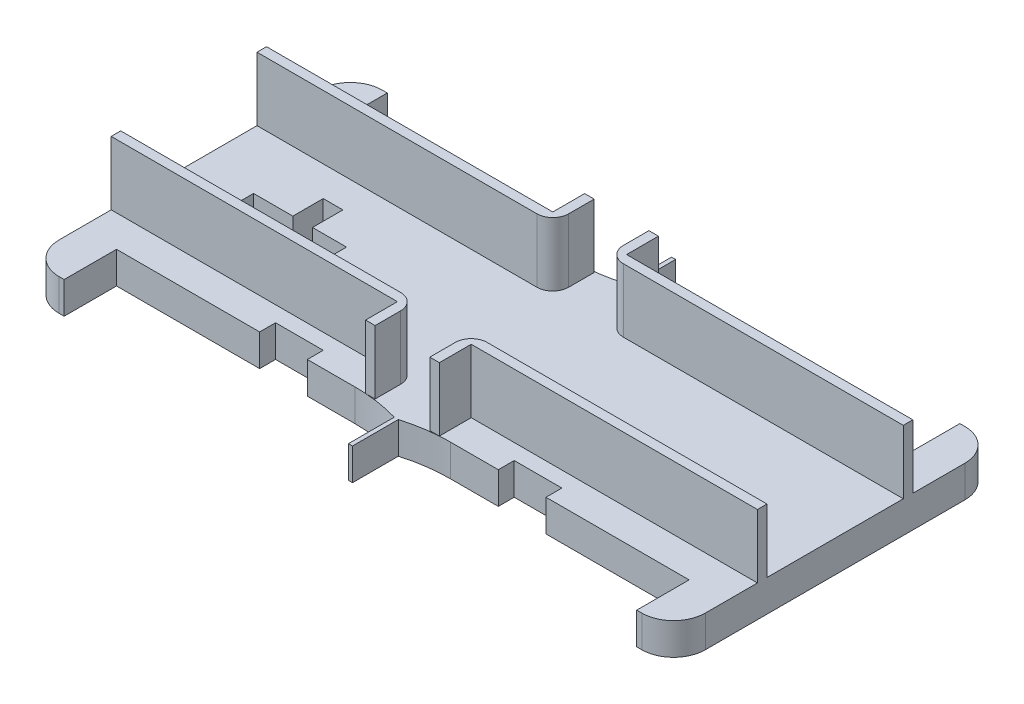
from build123d import *

# Parameters (mm, degrees)
SKETCH1_W            = 203.2
SKETCH1_H            = 101.6
BOSS_EXTRUDE1_DEPTH  = 10
CUT_EXTRUDE1_DEPTH   = 115.031574575
MIRROR3_COPY_1_DEPTH = 115.031574575
FILLET2_R            = 10
FILLET3_R            = 10
FILLET4_R            = 10
FILLET5_R            = 10
CUT_EXTRUDE2_DEPTH   = 115.031574575
BOSS_EXTRUDE8_DEPTH  = 20
FILLET9_R            = 5
FILLET9_OF_MIRROR7_R = 5
MIRROR9_START        = 10
MIRROR9_DEPTH        = 20


# Read off the part's stored shape, not the designer's step: Mirror9
with BuildPart() as part:
    # Sketch1 → Boss-Extrude1 (new body)
    with BuildSketch(Plane(origin=(0, 0, 0), x_dir=(1, 0, 0), z_dir=(0, 1, 0))):
        Rectangle(SKETCH1_W, SKETCH1_H)
    extrude(amount=BOSS_EXTRUDE1_DEPTH)

    # Sketch4 → Cut-Extrude1 (cut, through all)
    with BuildSketch(Plane(origin=(0, 10, 0), x_dir=(1, 0, 0), z_dir=(0, 1, 0))):
        with BuildLine():
            Line((-30.016608914, 34.326781051), (-15.016608914, 34.326781051))
            ThreePointArc((-15.016608914, 34.326781051), (-7.755121488, 34.843235841), (-0.639820714, 36.382203056))
            Line((-0.639820714, 36.382203056), (-0.639820714, 56.908402461))
            Line((-0.639820714, 56.908402461), (-90.016608914, 56.908402461))
            Line((-90.016608914, 56.908402461), (-90.016608914, 34.326781051))
            Line((-90.016608914, 34.326781051), (-45.016608914, 34.326781051))
            Line((-45.016608914, 34.326781051), (-45.016608914, 29.326781051))
            Line((-45.016608914, 29.326781051), (-30.016608914, 29.326781051))
            Line((-30.016608914, 29.326781051), (-30.016608914, 34.326781051))
        make_face()
    cut_extrude1 = extrude(amount=-CUT_EXTRUDE1_DEPTH, mode=Mode.SUBTRACT)

    # Mirror2: Cut-Extrude1 across plane
    add(cut_extrude1.mirror(Plane.XY), mode=Mode.SUBTRACT)

    # Mirror3: Cut-Extrude1 across plane
    add(cut_extrude1.mirror(Plane(origin=(0, 0, 0), x_dir=(0, 0, 1), z_dir=(1, 0, 0))), mode=Mode.SUBTRACT)

    # Mirror3 copy 1 sketch → Mirror3 copy 1 (cut, through all)
    with BuildSketch(Plane(origin=(0, 10, 0), x_dir=(-1, 0, 0), z_dir=(0, 1, 0))):
        with BuildLine():
            Line((-30.016608914, 34.326781051), (-15.016608914, 34.326781051))
            ThreePointArc((-15.016608914, 34.326781051), (-7.755121488, 34.843235841), (-0.639820714, 36.382203056))
            Line((-0.639820714, 36.382203056), (-0.639820714, 56.908402461))
            Line((-0.639820714, 56.908402461), (-90.016608914, 56.908402461))
            Line((-90.016608914, 56.908402461), (-90.016608914, 34.326781051))
            Line((-90.016608914, 34.326781051), (-45.016608914, 34.326781051))
            Line((-45.016608914, 34.326781051), (-45.016608914, 29.326781051))
            Line((-45.016608914, 29.326781051), (-30.016608914, 29.326781051))
            Line((-30.016608914, 29.326781051), (-30.016608914, 34.326781051))
        make_face()
    extrude(amount=-MIRROR3_COPY_1_DEPTH, mode=Mode.SUBTRACT)

    # Fillet2
    fillet2_edges = [part.edges().sort_by_distance(p)[0] for p in [
        (-101.6, 5, 50.8),
    ]]
    fillet(fillet2_edges, radius=FILLET2_R)

    # Fillet3
    fillet3_edges = [part.edges().sort_by_distance(p)[0] for p in [
        (-101.6, 5, -50.8),
    ]]
    fillet(fillet3_edges, radius=FILLET3_R)

    # Fillet4
    fillet4_edges = [part.edges().sort_by_distance(p)[0] for p in [
        (101.6, 5, -50.8),
    ]]
    fillet(fillet4_edges, radius=FILLET4_R)

    # Fillet5
    fillet5_edges = [part.edges().sort_by_distance(p)[0] for p in [
        (101.6, 5, 50.8),
    ]]
    fillet(fillet5_edges, radius=FILLET5_R)

    # Sketch6 → Cut-Extrude2 (cut, through all)
    with BuildSketch(Plane(origin=(0, 10, 0), x_dir=(1, 0, 0), z_dir=(0, 1, 0))):
        Polygon((-65.154466358, 2.427920334), (-54.461184026, 2.427920334), (-54.461184026, -2.324649591), (-65.154466358, -2.324649591), (-65.154466358, -13.017931923), (-71.33280726, -13.017931923), (-71.33280726, -2.324649591), (-83.689489065, -2.324649591), (-83.689489065, 2.427920334), (-71.33280726, 2.427920334), (-71.33280726, 11.982068077), (-65.154466358, 11.982068077), align=None)
    extrude(amount=-CUT_EXTRUDE2_DEPTH, mode=Mode.SUBTRACT)

    # Sketch11 → Boss-Extrude8 (add)
    with BuildSketch(Plane(origin=(0, 10, 0), x_dir=(1, 0, 0), z_dir=(0, 1, 0))):
        Polygon((-101.6, 24.424351811), (-11.6, 24.424351811), (-11.6, 34.440665029), (-8.6, 34.440665029), (-8.6, 21.424351811), (-101.6, 21.424351811), align=None)
    boss_extrude8 = extrude(amount=BOSS_EXTRUDE8_DEPTH)

    # Fillet9
    fillet9_edges = [part.edges().sort_by_distance(p)[0] for p in [
        (-8.6, 20, -21.424351811),
    ]]
    fillet(fillet9_edges, radius=FILLET9_R)

    # Mirror7: Boss-Extrude8 across plane
    add(boss_extrude8.mirror(Plane.XY))

    # Fillet9 of Mirror7
    fillet9_of_mirror7_edges = [part.edges().sort_by_distance(p)[0] for p in [
        (-8.6, 20, 21.424351811),
    ]]
    fillet(fillet9_of_mirror7_edges, radius=FILLET9_OF_MIRROR7_R)

    # Mirror9 outline → Mirror9 (add)
    with BuildSketch(Plane(origin=(0, 0, 0), x_dir=(1, 0, 0), z_dir=(0, 1, 0)).offset(MIRROR9_START)):
        with BuildLine():
            Line((11.6, 24.424351811), (11.6, 34.440665029))
            Line((11.6, 34.440665029), (8.6, 34.440665029))
            Line((8.6, 34.440665029), (8.6, 26.424351811))
            ThreePointArc((8.6, 26.424351811), (10.064466094, 22.888817905), (13.6, 21.424351811))
            Line((13.6, 21.424351811), (101.6, 21.424351811))
            Line((101.6, 21.424351811), (101.6, 24.424351811))
            Line((101.6, 24.424351811), (11.6, 24.424351811))
        make_face()
        with BuildLine():
            Line((101.6, -24.424351811), (101.6, -21.424351811))
            Line((101.6, -21.424351811), (13.6, -21.424351811))
            ThreePointArc((13.6, -21.424351811), (10.064466094, -22.888817905), (8.6, -26.424351811))
            Line((8.6, -26.424351811), (8.6, -34.440665029))
            Line((8.6, -34.440665029), (11.6, -34.440665029))
            Line((11.6, -34.440665029), (11.6, -24.424351811))
            Line((11.6, -24.424351811), (101.6, -24.424351811))
        make_face()
    extrude(amount=MIRROR9_DEPTH)


solid = part.part
